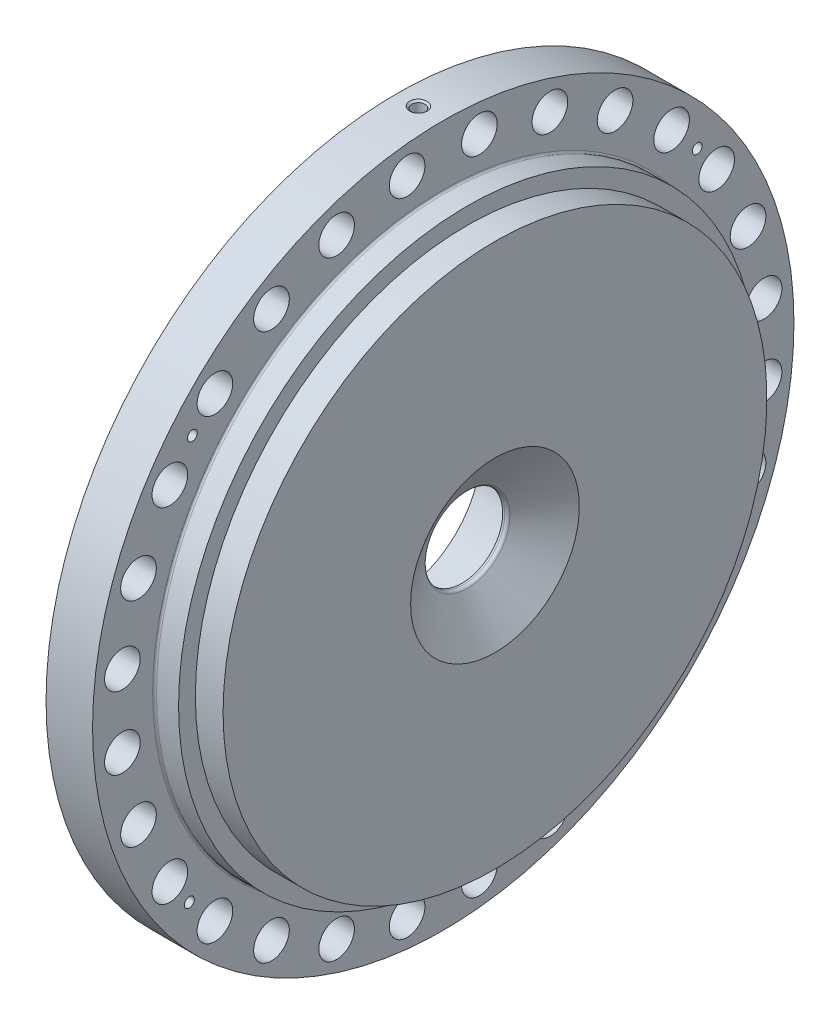
from build123d import *

# Parameters (mm, degrees)
SKETCH4_R                         = 14.2875
CUT_EXTRUDE1_DEPTH                = 406.190469782
CIRPATTERN2_COUNT                 = 28
CIRPATTERN3_COUNT                 = 12
CIRPATTERN4_COUNT                 = 4
CIRPATTERN5_COUNT                 = 56
F_1_2_13_TAPPED_HOLE4_D           = 10.71626
F_1_2_13_TAPPED_HOLE4_DEPTH       = 35.052
F_1_2_13_TAPPED_HOLE4_CSINK_D     = 13.97
F_1_2_13_TAPPED_HOLE4_CSINK_ANGLE = 100
F_1_2_13_TAPPED_HOLE4_TIP         = 3.219489309
FILLET1_R                         = 1.524
FILLET2_R                         = 4.7752
FILLET3_R                         = 1.524


with BuildPart() as part:
    # Sketch1 → Revolve1 (revolve)
    with BuildSketch(Plane.XY, mode=Mode.PRIVATE) as revolve1_sk:
        with BuildLine():
            Line((-4.7752, 67.5132), (-4.7752, 180.9496))
            Line((-4.7752, 180.9496), (0, 180.9496))
            Line((0, 180.9496), (0, 228.9937))
            Line((0, 228.9937), (-4.7752, 228.9937))
            Line((-4.7752, 228.9937), (-4.7752, 281.051))
            Line((-4.7752, 281.051), (32.512, 281.051))
            Line((32.512, 281.051), (32.512, 231.3686))
            Line((32.512, 231.3686), (51.7398, 231.3686))
            Line((51.7398, 231.3686), (51.7398, 217.9066))
            Line((51.7398, 217.9066), (73.9648, 217.9066))
            Line((73.9648, 217.9066), (73.9648, 67.6275))
            Line((73.9648, 67.6275), (51.892823931, 33.9957528))
            ThreePointArc((51.892823931, 33.9957528), (50.746661337, 32.943911593), (49.238413158, 32.5628))
            Line((49.238413158, 32.5628), (47.625, 32.5628))
            Line((47.625, 32.5628), (47.625, 67.5132))
            Line((47.625, 67.5132), (-4.7752, 67.5132))
        make_face()
    revolve(revolve1_sk.sketch.rotate(Axis((0, 0, 0), (1, 0, 0)), 90), axis=Axis((0, 0, 0), (1, 0, 0)))

    # Sketch4 → Cut-Extrude1 (cut, through all)
    with BuildSketch(Plane.ZY.offset(4.7752)):
        with Locations((28.972111579, 257.135466548)):
            Circle(SKETCH4_R)
    cut_extrude1 = extrude(amount=-CUT_EXTRUDE1_DEPTH, mode=Mode.SUBTRACT)

    # CirPattern2: Cut-Extrude1 ×28 about axis
    cirpattern2_axis = Axis((0, 0, 0), (1, 0, 0))
    for i in range(1, CIRPATTERN2_COUNT):
        add(cut_extrude1.rotate(cirpattern2_axis, i * 360 / CIRPATTERN2_COUNT), mode=Mode.SUBTRACT)

    # Sketch8 → 3/4-10 Tapped Hole1 (revolve, cut)
    with BuildSketch(Plane(origin=(0, 199.3429424, 53.413780433), x_dir=(0, 0, 1), z_dir=(0, 1, 0))):
        Polygon((0, 0), (0, 30.407416175), (8.33374, 25.4), (8.33374, 1.82626), (10.16, 0), align=None)
    f_3_4_10_tapped_hole1 = revolve(axis=Axis((-6.35, 199.3429424, 53.413780433), (1, 0, 0)), mode=Mode.SUBTRACT)

    # CirPattern3: 3/4-10 Tapped Hole1 ×12 about axis
    cirpattern3_axis = Axis((0, 0, 0), (1, 0, 0))
    for i in range(1, CIRPATTERN3_COUNT):
        add(f_3_4_10_tapped_hole1.rotate(cirpattern3_axis, i * 360 / CIRPATTERN3_COUNT), mode=Mode.SUBTRACT)

    # Sketch10 → 7/8-9 Tapped Hole1 (revolve, cut)
    with BuildSketch(Plane(origin=(-4.7752, 67.172315786, 67.172315786), x_dir=(0, 0, 1), z_dir=(0, 1, 0))):
        Polygon((0, 0), (0, 31.242239902), (9.72312, 25.4), (9.72312, 2.02438), (11.7475, 0), align=None)
    f_7_8_9_tapped_hole1 = revolve(axis=Axis((-11.1252, 67.172315786, 67.172315786), (1, 0, 0)), mode=Mode.SUBTRACT)

    # CirPattern4: 7/8-9 Tapped Hole1 ×4 about axis
    cirpattern4_axis = Axis((0, 0, 0), (1, 0, 0))
    for i in range(1, CIRPATTERN4_COUNT):
        add(f_7_8_9_tapped_hole1.rotate(cirpattern4_axis, i * 360 / CIRPATTERN4_COUNT), mode=Mode.SUBTRACT)

    # Sketch21 → Tap Drill for 3/8-16 Tap1 (revolve, cut)
    with BuildSketch(Plane(origin=(-4.7752, 162.844517689, 201.096231852), x_dir=(0, 0, 1), z_dir=(0, 1, 0))):
        Polygon((0, 0), (0, 43.024665582), (3.96875, 40.64), (3.96875, 0.635), (4.60375, 0), align=None)
    tap_drill_for_3_8_16_tap1 = revolve(axis=Axis((-11.1252, 162.844517689, 201.096231852), (1, 0, 0)), mode=Mode.SUBTRACT)

    # CirPattern5: Tap Drill for 3/8-16 Tap1 ×56 about axis, 52 skipped
    cirpattern5_axis = Axis((0, 0, 0), (-1, 0, 0))
    add([tap_drill_for_3_8_16_tap1.rotate(cirpattern5_axis, i * 360 / CIRPATTERN5_COUNT) for i in range(1, CIRPATTERN5_COUNT) if i not in (1, 2, 3, 4, 5, 6, 7, 8, 9, 10, 11, 12, 13, 14, 15, 17, 18, 19, 20, 21, 22, 23, 24, 25, 26, 27, 29, 30, 31, 32, 33, 34, 35, 36, 37, 38, 39, 40, 41, 42, 43, 45, 46, 47, 48, 49, 50, 51, 52, 53, 54, 55)], mode=Mode.SUBTRACT)

    # 1/2-13 Tapped Hole4
    with Locations(Plane(origin=(12.5984, 281.051, 0), x_dir=(0, 0, 1), z_dir=(0, 1, 0))):
        with Locations((0, 0)):
            CounterSinkHole(F_1_2_13_TAPPED_HOLE4_D / 2, F_1_2_13_TAPPED_HOLE4_CSINK_D / 2, depth=F_1_2_13_TAPPED_HOLE4_DEPTH, counter_sink_angle=F_1_2_13_TAPPED_HOLE4_CSINK_ANGLE)
            with Locations((0, 0, -(F_1_2_13_TAPPED_HOLE4_DEPTH + F_1_2_13_TAPPED_HOLE4_TIP / 2))):  # 118° drill point
                Cone(0, F_1_2_13_TAPPED_HOLE4_D / 2, F_1_2_13_TAPPED_HOLE4_TIP, mode=Mode.SUBTRACT)

    # Fillet1
    fillet1_edges = [part.edges().sort_by_distance(p)[0] for p in [
        (32.512, 0, -231.3686),
    ]]
    fillet(fillet1_edges, radius=FILLET1_R)

    # Fillet2
    fillet2_edges = [part.edges().sort_by_distance(p)[0] for p in [
        (0, 0, -228.9937),
    ]]
    fillet(fillet2_edges, radius=FILLET2_R - 0.0001)  # a hair under: the kernel refuses the full size

    # Fillet3
    fillet3_edges = [part.edges().sort_by_distance(p)[0] for p in [
        (0, 0, -180.9496),
    ]]
    fillet(fillet3_edges, radius=FILLET3_R)


solid = part.part
